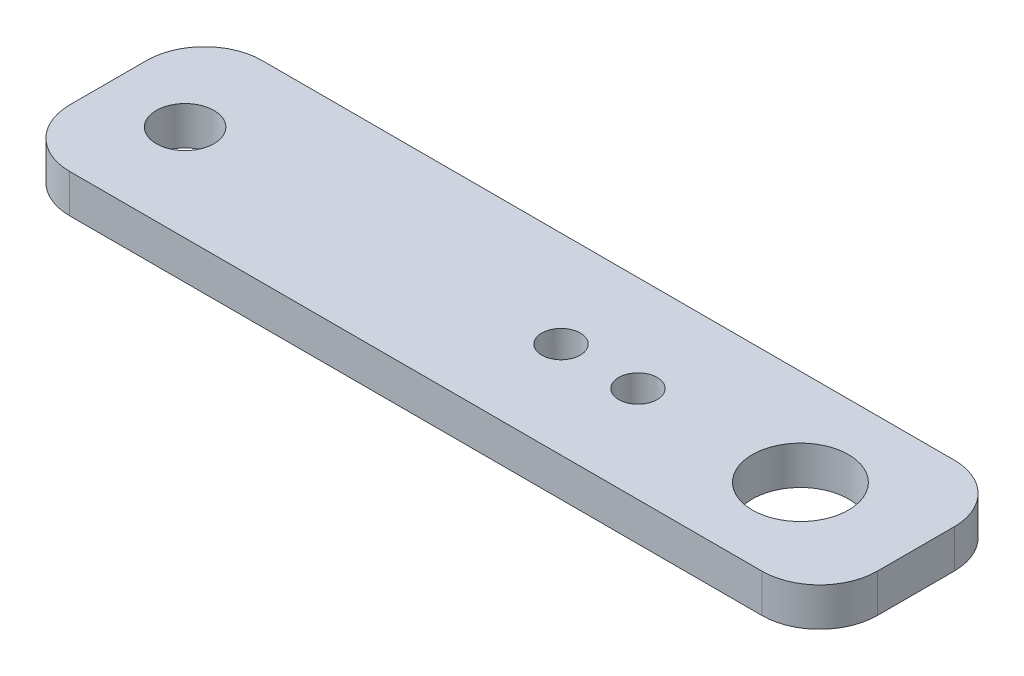
from build123d import *

# Parameters (mm, degrees)
SKETCH1_W             = 42
SKETCH1_H             = 10
BOSS_EXTRUDE1_DEPTH   = 2
F_5_0MM_DOWEL_HOLE1_D = 5
F_3_0MM_DOWEL_HOLE1_D = 3
SKETCH2_R             = 1
CUT_EXTRUDE1_DEPTH    = 3
FILLET1_R             = 3


with BuildPart() as part:
    # Sketch1 → Boss-Extrude1 (new body)
    with BuildSketch(Plane(origin=(0, 0, 0), x_dir=(1, 0, 0), z_dir=(0, 1, 0))):
        Rectangle(SKETCH1_W, SKETCH1_H)
    extrude(amount=BOSS_EXTRUDE1_DEPTH)

    # Ø5.0mm Dowel Hole1 (through all)
    with Locations(Plane(origin=(0, 2, 0), x_dir=(1, 0, 0), z_dir=(0, 1, 0))):
        with Locations((15, 0)):
            Hole(F_5_0MM_DOWEL_HOLE1_D / 2)

    # Ø3.0mm Dowel Hole1 (through all)
    with Locations(Plane(origin=(0, 2, 0), x_dir=(1, 0, 0), z_dir=(0, 1, 0))):
        with Locations((-17, 0)):
            Hole(F_3_0MM_DOWEL_HOLE1_D / 2)

    # Sketch2 → Cut-Extrude1 (cut)
    with BuildSketch(Plane(origin=(0, 2, 0), x_dir=(1, 0, 0), z_dir=(0, 1, 0))):
        with Locations((6.55, 0)):
            Circle(SKETCH2_R)
        with Locations((2.55, 0)):
            Circle(SKETCH2_R)
    extrude(amount=-CUT_EXTRUDE1_DEPTH, mode=Mode.SUBTRACT)

    # Fillet1
    fillet1_edges = [part.edges().sort_by_distance(p)[0] for p in [
        (21, 1, 5),
        (21, 1, -5),
        (-21, 1, -5),
        (-21, 1, 5),
    ]]
    fillet(fillet1_edges, radius=FILLET1_R)


solid = part.part
